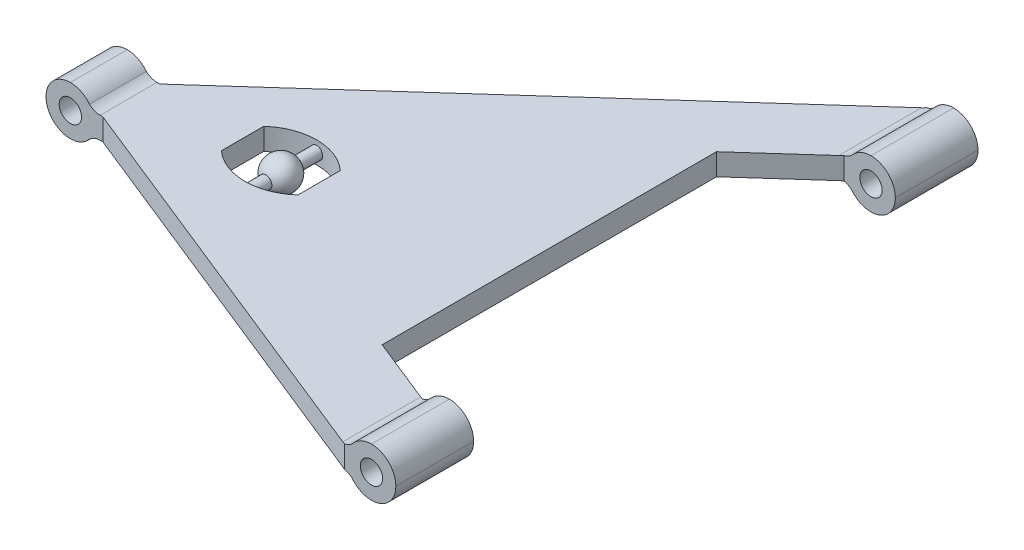
from build123d import *

# Parameters (mm, degrees)
BOSS_EXTRUDE1_DEPTH      = 3
BOSS_EXTRUDE1_DEPTH_BACK = 3
CUT_EXTRUDE1_DEPTH       = 77.793105304
CUT_EXTRUDE1_DEPTH_BACK  = 77.793105304
SKETCH2_R                = 1.375
FILLET2_R                = 3


with BuildPart() as part:
    # Sketch1 → Boss-Extrude1 (new, two sides: drawn at the far end of the back side and taken through both)
    with BuildSketch(Plane(origin=(0, 0, 0), x_dir=(1, 0, 0), z_dir=(0, 1, 0)).offset(-BOSS_EXTRUDE1_DEPTH_BACK)):
        Polygon((0, 41.898993428), (-49.75, -2.75), (-56.75, -2.75), (-56.75, -9.75), (-49.75, -9.75), (0, -29.761006572), (6.321904272, -29.761006572), (6.321904272, -20.181495095), (0, -20.181495095), (-8.267104031, -16.856207194), (-8.267104031, 24.303580089), (0, 31.723034833), (6.321904272, 31.723034833), (6.321904272, 41.898993428), align=None)
        with BuildLine():
            Line((-38.84115752, -6.072372844), (-38.84115752, -0.855123784))
            ThreePointArc((-38.84115752, -0.855123784), (-34.127327229, 0.958977223), (-29.413496938, -0.855123784))
            Line((-29.413496938, -0.855123784), (-29.413496938, -6.072372844))
            ThreePointArc((-29.413496938, -6.072372844), (-34.127327229, -7.886473851), (-38.84115752, -6.072372844))
        make_face(mode=Mode.SUBTRACT)
    extrude(amount=BOSS_EXTRUDE1_DEPTH + BOSS_EXTRUDE1_DEPTH_BACK)

    # Sketch2 → Cut-Extrude1 (cut, two sides: drawn at the far end of the back side and taken through both)
    with BuildSketch(Plane.XY.offset(9.75).offset(-CUT_EXTRUDE1_DEPTH_BACK)):
        with Locations((-53.75, 0)):
            Circle(SKETCH2_R)
        with Locations((3.321904272, 0)):
            Circle(SKETCH2_R)
        with BuildLine():
            Line((-53.75, -3), (-53.75, -4.40506942))
            Line((-53.75, -4.40506942), (3.321904272, -4.40506942))
            Line((3.321904272, -4.40506942), (3.321904272, -3))
            ThreePointArc((3.321904272, -3), (2.013077646, -2.699439361), (0.966505531, -1.857981908))
            ThreePointArc((0.966505531, -1.857981908), (0.3635922, -1.473684928), (-0.338629648, -1.339248585))
            Line((-0.338629648, -1.339248585), (-50.08946608, -1.339248585))
            ThreePointArc((-50.08946608, -1.339248585), (-50.791687928, -1.473684928), (-51.394601259, -1.857981908))
            ThreePointArc((-51.394601259, -1.857981908), (-52.441173374, -2.699439361), (-53.75, -3))
        make_face()
        with BuildLine():
            Line((3.321904272, 3), (3.321904272, 4.40506942))
            Line((3.321904272, 4.40506942), (-53.75, 4.40506942))
            Line((-53.75, 4.40506942), (-53.75, 3))
            ThreePointArc((-53.75, 3), (-52.441173374, 2.699439361), (-51.394601259, 1.857981908))
            ThreePointArc((-51.394601259, 1.857981908), (-50.791687928, 1.473684928), (-50.08946608, 1.339248585))
            Line((-50.08946608, 1.339248585), (-0.338629648, 1.339248585))
            ThreePointArc((-0.338629648, 1.339248585), (0.3635922, 1.473684928), (0.966505531, 1.857981908))
            ThreePointArc((0.966505531, 1.857981908), (2.013077646, 2.699439361), (3.321904272, 3))
        make_face()
    extrude(amount=CUT_EXTRUDE1_DEPTH + CUT_EXTRUDE1_DEPTH_BACK, mode=Mode.SUBTRACT)

    # Fillet2
    fillet2_edges = [part.edges().sort_by_distance(p)[0] for p in [
        (6.321904272, 3, -36.811014131),
        (6.321904272, -3, -36.811014131),
        (6.321904272, -3, 24.971250833),
        (6.321904272, 3, 24.971250833),
        (-56.75, -3, 6.25),
        (-56.75, 3, 6.25),
    ]]
    fillet(fillet2_edges, radius=FILLET2_R - 0.0001)  # a hair under: the kernel refuses the full size

    # Sketch3 → Revolve1 (revolve)
    with BuildSketch(Plane(origin=(0, 0, 0), x_dir=(1, 0, 0), z_dir=(0, 1, 0)), mode=Mode.PRIVATE) as revolve1_sk:
        with BuildLine():
            Line((-34.127327229, 0.958977223), (-33.377327229, 0.958977223))
            Line((-33.377327229, 0.958977223), (-33.377327229, -1.609698692))
            ThreePointArc((-33.377327229, -1.609698692), (-32.127327229, -3.463748314), (-33.377327229, -5.317797935))
            Line((-33.377327229, -5.317797935), (-33.377327229, -7.886473851))
            Line((-33.377327229, -7.886473851), (-34.127327229, -7.886473851))
            Line((-34.127327229, -7.886473851), (-34.127327229, 0.958977223))
        make_face()
    revolve(revolve1_sk.sketch.rotate(Axis((-34.127327229, 0, -0.958977223), (0, 0, 1)), 270), axis=Axis((-34.127327229, 0, -0.958977223), (0, 0, 1)))


solid = part.part
